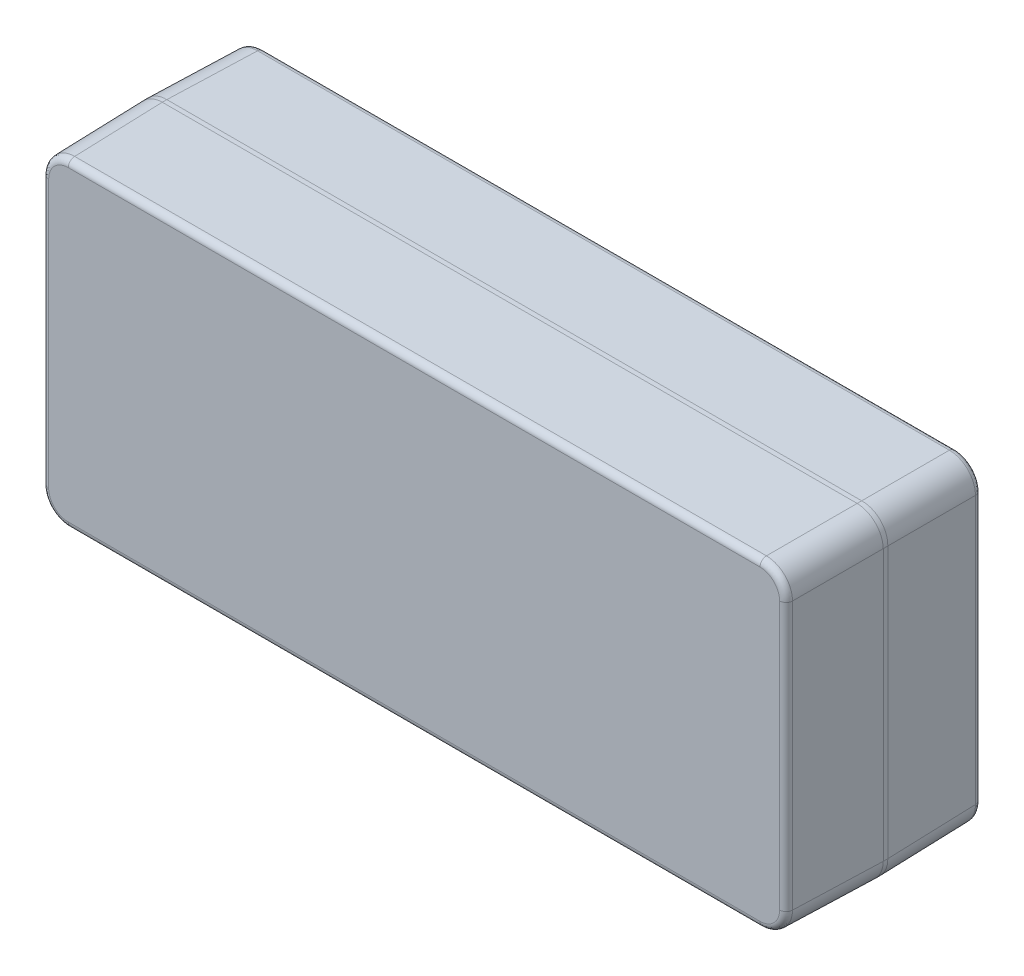
from build123d import *

# Parameters (mm, degrees)
SKETCH1_W               = 114
SKETCH1_H               = 49
BOSS_EXTRUDE1_DEPTH     = 15
BOSS_EXTRUDE1_DRAFT     = 1
MIRROR1_COPY_1_SKETCH_W = 114
MIRROR1_COPY_1_SKETCH_H = 49
MIRROR1_COPY_1_DEPTH    = 15
MIRROR1_COPY_1_DRAFT    = 1
FILLET1_R               = 20
FILLET2_R               = 4
FILLET3_R               = 1


with BuildPart() as part:
    # Sketch1 → Boss-Extrude1 (with draft: the straight prism first)
    with BuildSketch(Plane.XY):
        Rectangle(SKETCH1_W, SKETCH1_H)
    extrude(amount=-BOSS_EXTRUDE1_DEPTH)
    # Boss-Extrude1: the draft: its side faces are tilted about the plane it starts from
    boss_extrude1_sides = [part.faces().sort_by_distance(p)[0] for p in [
        (0, -24.5, -7.5),
        (57, 0, -7.5),
        (0, 24.5, -7.5),
        (-57, 0, -7.5),
    ]]
    draft(boss_extrude1_sides, Plane.XY, BOSS_EXTRUDE1_DRAFT)


with BuildPart() as mirror1_copy_1_tool:
    # Mirror1 copy 1 sketch → Mirror1 copy 1 (with draft: the straight prism first)
    with BuildSketch(Plane(origin=(0, 0, -30), x_dir=(1, 0, 0), z_dir=(0, 0, -1))):
        Rectangle(MIRROR1_COPY_1_SKETCH_W, MIRROR1_COPY_1_SKETCH_H)
    extrude(amount=-MIRROR1_COPY_1_DEPTH)
    # Mirror1 copy 1: the draft: its side faces are tilted about the plane it starts from
    mirror1_copy_1_sides = [mirror1_copy_1_tool.faces().sort_by_distance(p)[0] for p in [
        (0, -24.5, -22.5),
        (57, 0, -22.5),
        (0, 24.5, -22.5),
        (-57, 0, -22.5),
    ]]
    draft(mirror1_copy_1_sides, Plane(origin=(0, 0, -30), x_dir=(1, 0, 0), z_dir=(0, 0, -1)), MIRROR1_COPY_1_DRAFT)


with BuildPart() as part_1:
    add(part.part)

    # Mirror1 copy 1: add mirror1_copy_1_tool
    add(mirror1_copy_1_tool.part)

    # Fillet1
    # the kernel refuses this fillet: 20 mm, written as the material it takes off along each edge
    with BuildSketch(Plane(origin=(-57.261825974, 25.63457922, -15), x_dir=(0.017452406437286384, 0, 0.9998476951563912), z_dir=(0, -1, 0)), Plane(origin=(57.261825974, -25.63457922, -15), x_dir=(-0.017452406437286384, 0, 0.9998476951563912), z_dir=(0, 1, 0))) as fillet1_piece_1:
        with BuildLine():
            CenterArc((FILLET1_R * 0.0174550649282, -FILLET1_R), FILLET1_R, 90, 2)
            Line((-FILLET1_R * 0.0174444317743, -FILLET1_R * 0.000609172980904), (0, 0))
            Line((0, 0), (FILLET1_R * 0.0174550649282, 0))
        make_face()
    extrude(amount=51.269158441, mode=Mode.SUBTRACT)
    with BuildSketch(Plane(origin=(-58.13457922, -24.761825974, -15), x_dir=(0, 0.01745240643728647, 0.9998476951563912), z_dir=(1, 0, 0)), Plane(origin=(58.13457922, 24.761825974, -15), x_dir=(0, -0.01745240643728647, 0.9998476951563912), z_dir=(-1, 0, 0))) as fillet1_piece_2:
        with BuildLine():
            CenterArc((FILLET1_R * 0.0174550649282, -FILLET1_R), FILLET1_R, 90, 2)
            Line((-FILLET1_R * 0.0174444317743, -FILLET1_R * 0.000609172980904), (0, 0))
            Line((0, 0), (FILLET1_R * 0.0174550649282, 0))
        make_face()
    extrude(amount=116.269158441, mode=Mode.SUBTRACT)

    # Fillet2
    fillet2_edges = [part_1.edges().sort_by_distance(p)[0] for p in [
        (57.127866658, 24.627866658, -7.325475936),
        (-57.127866658, 24.627866658, -7.325475936),
        (-57.127866658, 24.627866658, -22.674524064),
        (57.127866658, 24.627866658, -22.674524064),
        (-57.127866658, -24.627866658, -7.325475936),
        (-57.127866658, -24.627866658, -22.674524064),
        (57.127866658, -24.627866658, -7.325475936),
        (57.127866658, -24.627866658, -22.674524064),
        (57.258017816, -24.758017816, -15.174537354),
        (-57.258779413, -24.758779413, -15),
        (57.258779413, 24.758779413, -15),
        (-57.258017816, 24.758017816, -15.174537354),
    ]]
    fillet(fillet2_edges, radius=FILLET2_R)

    # Fillet3
    fillet3_edges = [part_1.edges().sort_by_distance(p)[0] for p in [
        (57, 0, 0),
        (0, 24.5, 0),
        (-57, 0, 0),
        (0, -24.5, 0),
        (55.828679445, -23.328679445, 0),
        (-55.828679445, -23.328679445, 0),
        (-55.828679445, 23.328679445, 0),
        (55.828679445, 23.328679445, 0),
        (0, 24.5, -30),
        (57, 0, -30),
        (0, -24.5, -30),
        (-57, 0, -30),
        (55.828679445, -23.328679445, -30),
        (-55.828679445, -23.328679445, -30),
        (-55.828679445, 23.328679445, -30),
        (55.828679445, 23.328679445, -30),
    ]]
    fillet(fillet3_edges, radius=FILLET3_R)


solid = part_1.part
